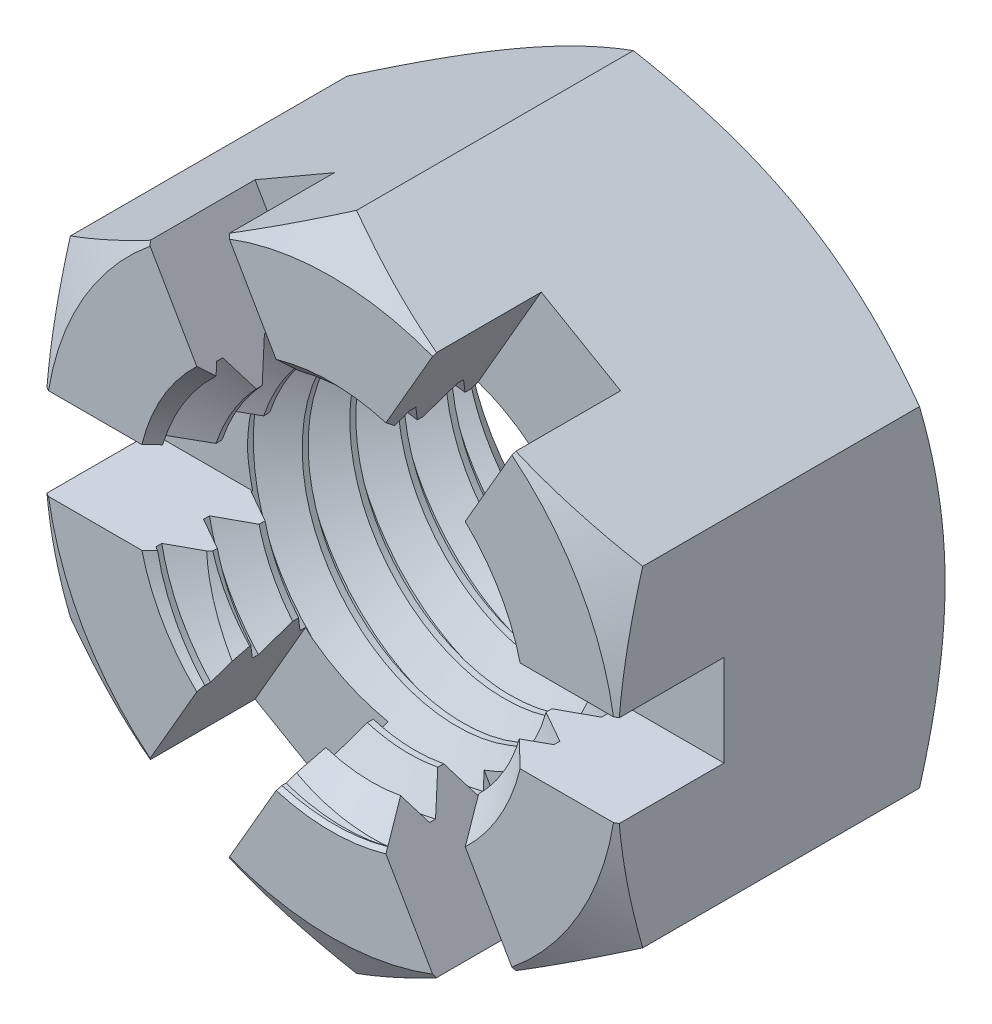
from build123d import *

# Parameters (mm, degrees)
EXTRUDE1_DEPTH     = 21.828125
SKETCH2_OUTSIDE_W  = 182.008
SKETCH2_OUTSIDE_H  = 187.902
SKETCH2_OUTSIDE_R  = 19.05
CUT_EXTRUDE1_DEPTH = 37.376359645
CUT_EXTRUDE1_DRAFT = -60
SKETCH3_OUTSIDE_W  = 182.008
SKETCH3_OUTSIDE_H  = 187.902
SKETCH3_OUTSIDE_R  = 19.05
CUT_EXTRUDE2_DEPTH = 37.376359645
CUT_EXTRUDE2_DRAFT = -60
SKETCH4_R          = 12.7
CUT_EXTRUDE3_DEPTH = 37.376359645
SKETCH12_R         = 12.7
SKETCH12_R_2       = 10.637777007
EXTRUDE2_DEPTH     = 21.828125
CUT_SWEEP1_PITCH   = 3.175
CUT_EXTRUDE8_DEPTH = 7.112
CIRPATTERN1_COUNT  = 6


with BuildPart() as part:
    # Sketch1 → Extrude1 (new body)
    with BuildSketch(Plane.XY):
        Polygon((0, 21.997045256), (-19.05, 10.998522628), (-19.05, -10.998522628), (0, -21.997045256), (19.05, -10.998522628), (19.05, 10.998522628), align=None)
    extrude(amount=-EXTRUDE1_DEPTH)


with BuildPart() as cut_extrude1_tool:
    # Sketch2 outside → Cut-Extrude1 (with draft: the straight prism first)
    with BuildSketch(Plane.XY):
        Rectangle(SKETCH2_OUTSIDE_W, SKETCH2_OUTSIDE_H)
        Circle(SKETCH2_OUTSIDE_R, mode=Mode.SUBTRACT)
    extrude(amount=-CUT_EXTRUDE1_DEPTH)
    # Cut-Extrude1: the draft: its side faces are tilted about the plane it starts from
    cut_extrude1_sides = [cut_extrude1_tool.faces().sort_by_distance(p)[0] for p in [
        (0, -93.951, -18.688179822),
        (91.004, 0, -18.688179822),
        (0, 93.951, -18.688179822),
        (-91.004, 0, -18.688179822),
        (-19.05, 0, -18.688179822),
    ]]
    draft(cut_extrude1_sides, Plane.XY, CUT_EXTRUDE1_DRAFT)


with BuildPart() as part_1:
    add(part.part)

    # Cut-Extrude1: cut by cut_extrude1_tool
    add(cut_extrude1_tool.part, mode=Mode.SUBTRACT)


with BuildPart() as cut_extrude2_tool:
    # Sketch3 outside → Cut-Extrude2 (with draft: the straight prism first)
    with BuildSketch(Plane(origin=(0, 0, -21.828125), x_dir=(-1, 0, 0), z_dir=(0, 0, -1))):
        Rectangle(SKETCH3_OUTSIDE_W, SKETCH3_OUTSIDE_H)
        Circle(SKETCH3_OUTSIDE_R, mode=Mode.SUBTRACT)
    extrude(amount=-CUT_EXTRUDE2_DEPTH)
    # Cut-Extrude2: the draft: its side faces are tilted about the plane it starts from
    cut_extrude2_sides = [cut_extrude2_tool.faces().sort_by_distance(p)[0] for p in [
        (0, -93.951, -3.139945178),
        (-91.004, 0, -3.139945178),
        (0, 93.951, -3.139945178),
        (91.004, 0, -3.139945178),
        (19.05, 0, -3.139945178),
    ]]
    draft(cut_extrude2_sides, Plane(origin=(0, 0, -21.828125), x_dir=(-1, 0, 0), z_dir=(0, 0, -1)), CUT_EXTRUDE2_DRAFT)


with BuildPart() as part_2:
    add(part_1.part)

    # Cut-Extrude2: cut by cut_extrude2_tool
    add(cut_extrude2_tool.part, mode=Mode.SUBTRACT)

    # Sketch4 → Cut-Extrude3 (cut, through all)
    with BuildSketch(Plane.XY):
        Circle(SKETCH4_R)
    extrude(amount=-CUT_EXTRUDE3_DEPTH, mode=Mode.SUBTRACT)

    # Sketch12 → Extrude2 (add)
    with BuildSketch(Plane.XY):
        Circle(SKETCH12_R)
        Circle(SKETCH12_R_2, mode=Mode.SUBTRACT)
    extrude(amount=-EXTRUDE2_DEPTH)

    # Cut-Sweep1: the profile of Sketch9 profile screwed along a right-hand helix of 7.875 turns, 6 arcs to a turn; built about Z, then put on its axis
    cut_sweep1_z = Axis((0, 0, 0), (0, 0, 1))
    cut_sweep1_corners = [(12.7, 0, -1.5875), (12.7, 0, -1.190625), (10.637477007, 0, 0.000173205), (10.637477007, 0, -2.778298205)]
    with BuildLine(mode=Mode.PRIVATE) as cut_sweep1_profile:
        Line(cut_sweep1_corners[0], cut_sweep1_corners[1])
        Line(cut_sweep1_corners[1], cut_sweep1_corners[2])
        Line(cut_sweep1_corners[2], cut_sweep1_corners[3])
        Line(cut_sweep1_corners[3], cut_sweep1_corners[0])
    cut_sweep1_cap = Face(cut_sweep1_profile.wire())
    cut_sweep1_turn_angles = [0, 30, 60, 90, 120, 150, 180, 210, 240, 270, 300, 330, 360]
    cut_sweep1_turn_weights = [1, 0.8660254037844387, 1, 0.8660254037844387, 1, 0.8660254037844387, 1, 0.8660254037844387, 1, 0.8660254037844387, 1, 0.8660254037844387, 1]
    cut_sweep1_turn_rails = [Edge.make_bspline([Vector(p[0], p[1], 0).rotate(cut_sweep1_z, cut_sweep1_turn_angles[k]) / cut_sweep1_turn_weights[k] + Vector(0, 0, p[2] + CUT_SWEEP1_PITCH * cut_sweep1_turn_angles[k] / 360) for k in range(13)], [0, 0, 0, 1, 1, 2, 2, 3, 3, 4, 4, 5, 5, 6, 6, 6], 2, cut_sweep1_turn_weights) for p in cut_sweep1_corners]
    cut_sweep1_turn_sides = [Face.make_surface_from_curves(cut_sweep1_turn_rails[p[0]], cut_sweep1_turn_rails[p[1]]) for p in [(0, 1), (1, 2), (2, 3), (3, 0)]]
    cut_sweep1_last_angles = [2520, 2550, 2580, 2610, 2640, 2670, 2700, 2730, 2760, 2790, 2820, 2827.5, 2835]
    cut_sweep1_last_weights = [1, 0.8660254037844387, 1, 0.8660254037844387, 1, 0.8660254037844387, 1, 0.8660254037844387, 1, 0.8660254037844387, 1, 0.9914448613738094, 1]
    cut_sweep1_last_rails = [Edge.make_bspline([Vector(p[0], p[1], 0).rotate(cut_sweep1_z, cut_sweep1_last_angles[k]) / cut_sweep1_last_weights[k] + Vector(0, 0, p[2] + CUT_SWEEP1_PITCH * cut_sweep1_last_angles[k] / 360) for k in range(13)], [0, 0, 0, 1, 1, 2, 2, 3, 3, 4, 4, 5, 5, 6, 6, 6], 2, cut_sweep1_last_weights) for p in cut_sweep1_corners]
    cut_sweep1_last_sides = [Face.make_surface_from_curves(cut_sweep1_last_rails[p[0]], cut_sweep1_last_rails[p[1]]) for p in [(0, 1), (1, 2), (2, 3), (3, 0)]]
    cut_sweep1 = Plane(origin=(0, 0, 0), x_dir=(0, 1, 0), z_dir=(0, 0, -1)) * Solid(Shell([*[p.moved(Location((0, 0, CUT_SWEEP1_PITCH * i))) for i in range(7) for p in cut_sweep1_turn_sides], *cut_sweep1_last_sides, cut_sweep1_cap, cut_sweep1_cap.rotate(cut_sweep1_z, 2835).moved(Location((0, 0, CUT_SWEEP1_PITCH * 2835 / 360)))]))
    add(cut_sweep1, mode=Mode.SUBTRACT)

    # Cut-Extrude6 cone 1 section (through the dimple's axis) → Cut-Extrude6 (revolve, cut)
    with BuildSketch(Plane(origin=(0, 0, 0), x_dir=(0, -1, 0), z_dir=(1, 0, 0))):
        Polygon((0, 0), (12.954, 0), (0, 12.954), align=None)
    revolve(axis=Axis((0, 0, 0), (0, 0, -1)), mode=Mode.SUBTRACT)

    # Cut-Extrude7 cone 1 section (through the dimple's axis) → Cut-Extrude7 (revolve, cut)
    with BuildSketch(Plane(origin=(0, 0, -21.828125), x_dir=(0, 1, 0), z_dir=(1, 0, 0))):
        Polygon((0, 0), (12.954, 0), (0, 12.954), align=None)
    revolve(axis=Axis((0, 0, -21.828125), (0, 0, 1)), mode=Mode.SUBTRACT)

    # Sketch13 → Cut-Extrude8 (cut)
    with BuildSketch(Plane.XY):
        Polygon((-2.639645431, 1.524), (2.639645431, -1.524), (12.164645431, 14.973783942), (6.885354569, 18.021783942), align=None)
    cut_extrude8 = extrude(amount=-CUT_EXTRUDE8_DEPTH, mode=Mode.SUBTRACT)

    # CirPattern1: Cut-Extrude8 ×6 about axis
    cirpattern1_axis = Axis((0, 0, 0), (0, 0, 1))
    for i in range(1, CIRPATTERN1_COUNT):
        add(cut_extrude8.rotate(cirpattern1_axis, i * 360 / CIRPATTERN1_COUNT), mode=Mode.SUBTRACT)


solid = part_2.part
